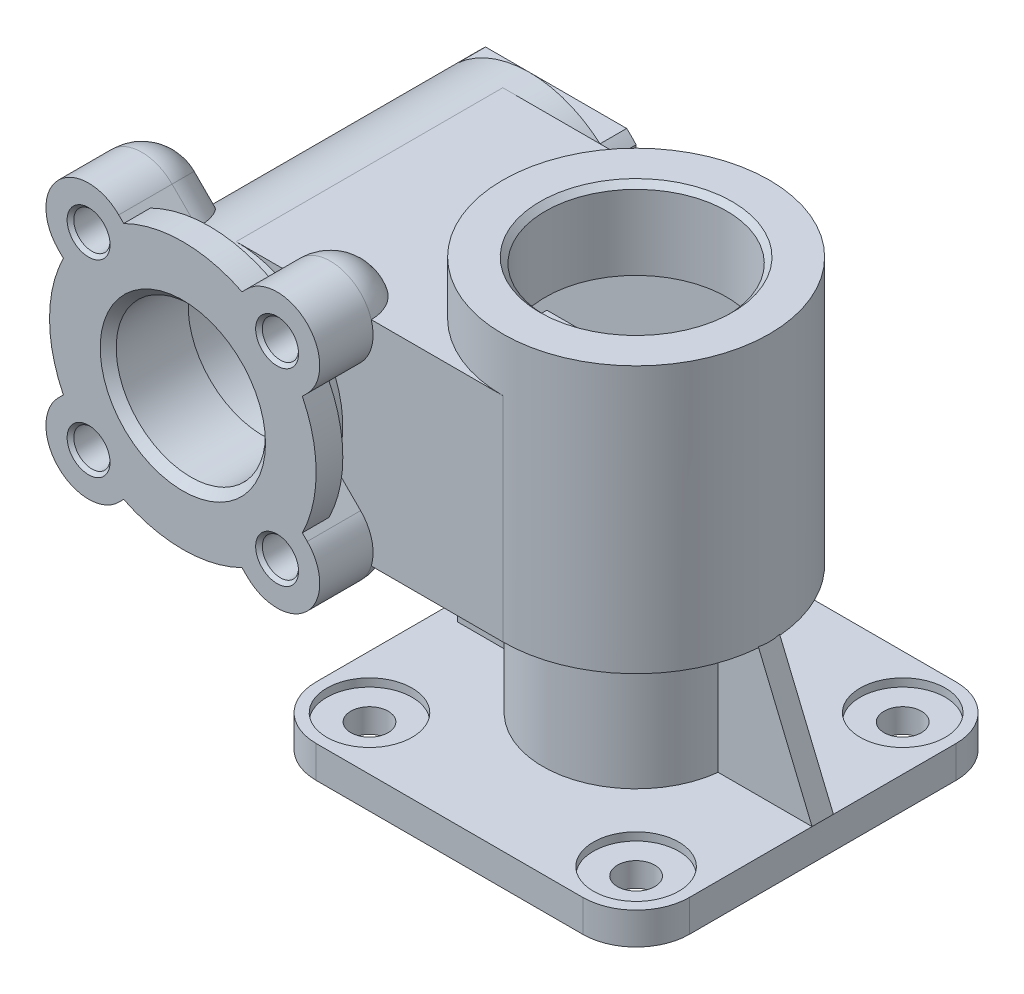
from build123d import *
from build123d.topology import SkipClean

# Parameters (mm, degrees)
EXTRUDE_1_DEPTH                            = 6
EXTRUDE_START                              = -6
SKETCH_2_R                                 = 17.5
EXTRUDE_2_DEPTH                            = 80
SKETCH_3_R                                 = 25
EXTRUDE_3_DEPTH                            = 50
SKETCH_5_R                                 = 20
EXTRUDE_4_DEPTH                            = 35
EXTRUDE_5_REACH                            = 113.915
EXTRUDE_5_END_RADIUS                       = 20
SKETCH_4_W                                 = 50
SKETCH_4_H                                 = 40
SKETCH_9_R                                 = 25
EXTRUDE_9_DEPTH                            = 5
EXTRUDE_8_DEPTH                            = 18
FILLET_1_R                                 = 8
PATTERN_CIRCULAR_7_COUNT                   = 4
CUT_EXTRUDE_START                          = -5
SKETCH_10_R                                = 20
CUT_EXTRUDE_2_DEPTH                        = 5
EXTRUDE_10_DEPTH                           = 5
RIB_1_REACH                                = 117.551
SKETCH_11_WALL_W                           = 259.102658406
SKETCH_11_WALL_H                           = 4
RIB_2_REACH                                = 117.551
SKETCH_12_WALL_W                           = 257.102658406
SKETCH_12_WALL_H                           = 4
SKETCH_13_R                                = 15
CUT_EXTRUDE_3_DEPTH                        = 20
CUT_EXTRUDE_START_2                        = -15
SKETCH_14_R                                = 20
CUT_EXTRUDE_4_DEPTH                        = 22
SKETCH_15_W                                = 50
SKETCH_15_H                                = 40
CUT_EXTRUDE_5_DEPTH                        = 22
SKETCH_16_R                                = 17.5
EXTRUDE_11_DEPTH                           = 3
F_25_0MM_1_D                               = 25
F_25_0MM_1_CSINK_D                         = 26.5
F_25_0MM_1_CSINK_ANGLE                     = 90
HOLE_WIZARD_M8_1_D                         = 6.8
HOLE_WIZARD_M8_1_DEPTH                     = 7.957073895
HOLE_WIZARD_M8_1_CSINK_D                   = 8.05
HOLE_WIZARD_M8_1_CSINK_ANGLE               = 90
HOLE_WIZARD_M8_1_TIP                       = 2.042926105
CUT_EXTRUDE_6_REACH                        = 132.488
SKETCH_23_R                                = 14
CHAMFER_1_SIZE                             = 1.5
M18X2_0_1_D                                = 16
M18X2_0_1_CSINK_D                          = 18.05
M18X2_0_1_CSINK_ANGLE                      = 90
SKETCH_27_R                                = 8
CUT_EXTRUDE_7_DEPTH                        = 1.5
CUT_EXTRUDE_8_REACH                        = 114.483
SKETCH_28_R                                = 3.5
MIRROR_1_AT_THE_SECOND_PLANE_COPY_1_SKET_R = 8
MIRROR_1_AT_THE_SECOND_PLANE_COPY_1_DEPTH  = 1.5
MIRROR_1_AT_THE_SECOND_PLANE_COPY_2_REACH  = 114.483
MIRROR_1_AT_THE_SECOND_PLANE_COPY_2_SKET_R = 3.5


with BuildPart() as part:
    # 草图1 → 凸台-拉伸1 (new body)
    with BuildSketch(Plane(origin=(0, 0, 0), x_dir=(1, 0, 0), z_dir=(0, 1, 0))):
        with BuildLine():
            Line((-25, -35), (25, -35))
            ThreePointArc((25, -35), (32.071067812, -32.071067812), (35, -25))
            Line((35, -25), (35, 25))
            ThreePointArc((35, 25), (32.071067812, 32.071067812), (25, 35))
            Line((25, 35), (-25, 35))
            ThreePointArc((-25, 35), (-32.071067812, 32.071067812), (-35, 25))
            Line((-35, 25), (-35, -25))
            ThreePointArc((-35, -25), (-32.071067812, -32.071067812), (-25, -35))
        make_face()
    extrude(amount=EXTRUDE_1_DEPTH)

    # 草图2 → 凸台-拉伸2 (add)
    with BuildSketch(Plane(origin=(0, 6, 0), x_dir=(1, 0, 0), z_dir=(0, 1, 0)).offset(EXTRUDE_START)):
        with Locations(Location((0, 0, 0), (0, 0, 270))):
            Circle(SKETCH_2_R)
    extrude(amount=EXTRUDE_2_DEPTH)

    # 草图3 → 凸台-拉伸3 (add)
    with BuildSketch(Plane(origin=(0, 80, 0), x_dir=(1, 0, 0), z_dir=(0, 1, 0))):
        with Locations(Location((0, 0, 0), (0, 0, 270))):
            Circle(SKETCH_3_R)
    extrude(amount=-EXTRUDE_3_DEPTH)



with BuildPart() as body_2:
    # 草图5 → 凸台-拉伸4 (new, symmetric)
    with BuildSketch(Plane.XY):
        with Locations((-50, 50)):
            Circle(SKETCH_5_R)
    extrude(amount=EXTRUDE_4_DEPTH, both=True)


with BuildPart() as part_1:
    add(part.part)

    add(body_2.part)  # 凸台-拉伸5 merges body 2
    # 凸台-拉伸5: up to this cylinder (the profile starts outside it)
    extrude_5_end = Plane(origin=(-50, 50, 0), z_dir=(0, 0, -1)) * Cylinder(EXTRUDE_5_END_RADIUS, 268.83, mode=Mode.PRIVATE)
    # 草图4 → 凸台-拉伸5 (add, up to the surface)
    with BuildSketch(Plane(origin=(0, 0, 0), x_dir=(0, 0, -1), z_dir=(1, 0, 0)), mode=Mode.PRIVATE) as extrude_5_sk1:
        with Locations((0, 50)):
            Rectangle(SKETCH_4_W, SKETCH_4_H)
    extrude_5_tool1 = extrude(extrude_5_sk1.sketch, amount=-EXTRUDE_5_REACH, mode=Mode.PRIVATE) - extrude_5_end
    add(extrude_5_tool1.solids().sort_by_distance((0, 50, 0))[0])

    # 草图9 → 凸台-拉伸9 (add)
    with BuildSketch(Plane.XY.offset(35)):
        with Locations((-50, 50)):
            Circle(SKETCH_9_R)
    extrude(amount=-EXTRUDE_9_DEPTH)


with BuildPart() as body_2_2:
    # 草图6 → 凸台-拉伸8 (new body)
    with BuildSketch(Plane.XY.offset(35)):
        with BuildLine():
            Line((-62.02081528, 73.334523779), (-44.343145751, 55.656854249))
            Line((-44.343145751, 55.656854249), (-55.656854249, 44.343145751))
            Line((-55.656854249, 44.343145751), (-73.334523779, 62.02081528))
            ThreePointArc((-73.334523779, 62.02081528), (-73.334523779, 73.334523779), (-62.02081528, 73.334523779))
        make_face()
    extrude(amount=-EXTRUDE_8_DEPTH)

    # 圆角1
    fillet_1_edges = [body_2_2.edges().sort_by_distance(p)[0] for p in [
        (-64.495689014, 53.181980515, 17),
        (-73.334523779, 73.334523779, 17),
        (-53.181980515, 64.495689014, 17),
    ]]
    fillet(fillet_1_edges, radius=FILLET_1_R - 0.0001)  # a hair under: the kernel refuses the full size


with BuildPart() as pattern_circular_7_1:
    # 阵列(圆周)7: pattern copy
    add(body_2_2.part.rotate(Axis((-50, 50, 0), (0, 0, 1)), 1 * 360 / PATTERN_CIRCULAR_7_COUNT))


with BuildPart() as pattern_circular_7_2:
    # 阵列(圆周)7: pattern copy
    add(body_2_2.part.rotate(Axis((-50, 50, 0), (0, 0, 1)), 2 * 360 / PATTERN_CIRCULAR_7_COUNT))


with BuildPart() as pattern_circular_7_3:
    # 阵列(圆周)7: pattern copy
    add(body_2_2.part.rotate(Axis((-50, 50, 0), (0, 0, 1)), 3 * 360 / PATTERN_CIRCULAR_7_COUNT))


with BuildPart() as part_2:
    add(part_1.part)

    # 相交1: read off the stored shape, not the designer's step
    # 相交1: union 阵列(圆周)7_3, 阵列(圆周)7_2, 阵列(圆周)7_1, body 2 2
    add(pattern_circular_7_3.part)
    add(pattern_circular_7_2.part)
    add(pattern_circular_7_1.part)
    add(body_2_2.part)

    # 草图10 → 切除-拉伸2 (cut)
    with BuildSketch(Plane(origin=(0, 0, -35), x_dir=(-1, 0, 0), z_dir=(0, 0, -1)).offset(CUT_EXTRUDE_START)):
        with Locations((50, 50)):
            Circle(SKETCH_10_R)
    extrude(amount=CUT_EXTRUDE_2_DEPTH, mode=Mode.SUBTRACT)

    # 草图7 → 凸台-拉伸10 (add)
    with SkipClean():  # the faces are left unmerged after this step: merging them gives an invalid solid
        with BuildSketch(Plane(origin=(0, 0, -30), x_dir=(-1, 0, 0), z_dir=(0, 0, -1))):
            with BuildLine():
                Line((36.771243445, 35), (63.228756555, 35))
                ThreePointArc((63.228756555, 35), (64.142135624, 35.857864376), (65, 36.771243445))
                Line((65, 36.771243445), (65, 63.228756555))
                ThreePointArc((65, 63.228756555), (64.142135624, 64.142135624), (63.228756555, 65))
                Line((63.228756555, 65), (36.771243445, 65))
                ThreePointArc((36.771243445, 65), (35.857864376, 64.142135624), (35, 63.228756555))
                Line((35, 63.228756555), (35, 36.771243445))
                ThreePointArc((35, 36.771243445), (35.857864376, 35.857864376), (36.771243445, 35))
            make_face()
        extrude(amount=EXTRUDE_10_DEPTH)

    # 草图11 wall → 筋1 (add, up to next)
    with BuildSketch(Plane(origin=(30, 18, 0), x_dir=(0.384615384615, -0.923076923077, 0), z_dir=(0.923076923077, 0.384615384615, 0)), mode=Mode.PRIVATE) as rib_1_sk1:
        Rectangle(SKETCH_11_WALL_W, SKETCH_11_WALL_H)
    rib_1_tool1 = extrude(rib_1_sk1.sketch, amount=-RIB_1_REACH, mode=Mode.PRIVATE) - part_2.part
    add(rib_1_tool1.solids().sort_by_distance((30, 18, 0))[0])

    # 草图12 wall → 筋2 (add, up to next)
    with BuildSketch(Plane(origin=(-31.5, 18, 0), x_dir=(0, 1, 0), z_dir=(-1, 0, 0)), mode=Mode.PRIVATE) as rib_2_sk1:
        Rectangle(SKETCH_12_WALL_W, SKETCH_12_WALL_H)
    rib_2_tool1 = extrude(rib_2_sk1.sketch, amount=-RIB_2_REACH, mode=Mode.PRIVATE) - part_2.part
    add(rib_2_tool1.solids().sort_by_distance((-31.5, 18, 0))[0])

    # 草图13 → 切除-拉伸3 (cut, symmetric)
    with SkipClean():  # the faces are left unmerged after this step: merging them gives an invalid solid
        with BuildSketch(Plane.XY):
            with Locations((-50, 50)):
                Circle(SKETCH_13_R)
        extrude(amount=CUT_EXTRUDE_3_DEPTH, both=True, mode=Mode.SUBTRACT)

    # 草图14 → 切除-拉伸4 (cut)
    with SkipClean():  # the faces are left unmerged after this step: merging them gives an invalid solid
        with BuildSketch(Plane(origin=(0, 80, 0), x_dir=(1, 0, 0), z_dir=(0, 1, 0)).offset(CUT_EXTRUDE_START_2)):
            with Locations(Location((0, 0, 0), (0, 0, 270))):
                Circle(SKETCH_14_R)
        extrude(amount=-CUT_EXTRUDE_4_DEPTH, mode=Mode.SUBTRACT)

    # 草图15 → 切除-拉伸5 (cut)
    with SkipClean():  # the faces are left unmerged after this step: merging them gives an invalid solid
        with BuildSketch(Plane(origin=(0, 43, 0), x_dir=(1, 0, 0), z_dir=(0, 1, 0))):
            with Locations((-25, 0)):
                Rectangle(SKETCH_15_W, SKETCH_15_H)
        extrude(amount=CUT_EXTRUDE_5_DEPTH, mode=Mode.SUBTRACT)

    # 草图16 → 凸台-拉伸11 (add)
    with SkipClean():  # the faces are left unmerged after this step: merging them gives an invalid solid
        with BuildSketch(Plane(origin=(0, 43, 0), x_dir=(1, 0, 0), z_dir=(0, 1, 0))):
            with Locations(Location((0, 0, 0), (0, 0, 270))):
                Circle(SKETCH_16_R)
        extrude(amount=EXTRUDE_11_DEPTH)

    # 草图18 → M36x2.0 螺纹孔1 (revolve, cut)
    with SkipClean():  # the faces are left unmerged after this step: merging them gives an invalid solid
        with BuildSketch(Plane(origin=(0, 80, 0), x_dir=(0, 0, 1), z_dir=(1, 0, 0))):
            Polygon((0, 0), (0, 15), (17, 15), (17, 1.025), (18.025, 0), align=None)
        revolve(axis=Axis((0, 86.35, 0), (0, -1, 0)), mode=Mode.SUBTRACT)

    # Ø25.0mm 暗销孔1 (through all)
    with Locations(Plane(origin=(0, 46, 0), x_dir=(1, 0, 0), z_dir=(0, 1, 0))):
        with Locations((0, 0)):
            CounterSinkHole(F_25_0MM_1_D / 2, F_25_0MM_1_CSINK_D / 2, counter_sink_angle=F_25_0MM_1_CSINK_ANGLE)

    # M8 螺纹孔1
    with Locations(Plane.XY.offset(35)):
        with Locations((-32.32233047, 32.32233047), (-67.67766953, 32.32233047), (-67.67766953, 67.67766953), (-32.32233047, 67.67766953)):
            CounterSinkHole(HOLE_WIZARD_M8_1_D / 2, HOLE_WIZARD_M8_1_CSINK_D / 2, depth=HOLE_WIZARD_M8_1_DEPTH, counter_sink_angle=HOLE_WIZARD_M8_1_CSINK_ANGLE)
            with Locations((0, 0, -(HOLE_WIZARD_M8_1_DEPTH + HOLE_WIZARD_M8_1_TIP / 2))):  # 118° drill point
                Cone(0, HOLE_WIZARD_M8_1_D / 2, HOLE_WIZARD_M8_1_TIP, mode=Mode.SUBTRACT)

    # 草图23 → 切除-拉伸6 (cut, up to next)
    with BuildSketch(Plane.XY.offset(35), mode=Mode.PRIVATE) as cut_extrude_6_sk1:
        with Locations((-50, 50)):
            Circle(SKETCH_23_R)
    cut_extrude_6_tool1 = extrude(cut_extrude_6_sk1.sketch, amount=-CUT_EXTRUDE_6_REACH, mode=Mode.PRIVATE) & part_2.part
    add(cut_extrude_6_tool1.solids().sort_by_distance((-50, 50, 35))[0], mode=Mode.SUBTRACT)

    # 倒角1
    chamfer_1_edges = [part_2.edges().sort_by_distance(p)[0] for p in [
        (-64, 50, 35),
    ]]
    chamfer(chamfer_1_edges, length=CHAMFER_1_SIZE)

    # M18x2.0 螺纹孔1 (through all)
    with Locations(Plane(origin=(0, 0, -35), x_dir=(-1, 0, 0), z_dir=(0, 0, -1))):
        with Locations((50, 50)):
            CounterSinkHole(M18X2_0_1_D / 2, M18X2_0_1_CSINK_D / 2, counter_sink_angle=M18X2_0_1_CSINK_ANGLE)

    # 草图27 → 切除-拉伸7 (cut)
    with SkipClean():  # the faces are left unmerged after this step: merging them gives an invalid solid
        with BuildSketch(Plane(origin=(0, 6, 0), x_dir=(1, 0, 0), z_dir=(0, 1, 0))):
            with Locations(Location((25, -25, 0), (0, 0, 270))):
                Circle(SKETCH_27_R)
        cut_extrude_7 = extrude(amount=-CUT_EXTRUDE_7_DEPTH, mode=Mode.SUBTRACT)

    # 草图28 → 切除-拉伸8 (cut, up to next)
    with BuildSketch(Plane(origin=(0, 4.5, 0), x_dir=(1, 0, 0), z_dir=(0, 1, 0)), mode=Mode.PRIVATE) as cut_extrude_8_sk1:
        with Locations(Location((25, -25, 0), (0, 0, 270))):
            Circle(SKETCH_28_R)
    cut_extrude_8_tool1 = extrude(cut_extrude_8_sk1.sketch, amount=-CUT_EXTRUDE_8_REACH, mode=Mode.PRIVATE) & part_2.part
    cut_extrude_8 = cut_extrude_8_tool1.solids().sort_by_distance((25, 4.5, 25))[0]
    add(cut_extrude_8, mode=Mode.SUBTRACT)

    # 镜向1: 切除-拉伸7, 切除-拉伸8 across plane
    with SkipClean():  # the faces are left unmerged after this step: merging them gives an invalid solid
        add(cut_extrude_7.mirror(Plane(origin=(0, 0, 0), x_dir=(0, 0, 1), z_dir=(1, 0, 0))), mode=Mode.SUBTRACT)
        add(cut_extrude_8.mirror(Plane(origin=(0, 0, 0), x_dir=(0, 0, 1), z_dir=(1, 0, 0))), mode=Mode.SUBTRACT)

    # 镜向1 at the second plane: 切除-拉伸7, 切除-拉伸8 across plane
    with SkipClean():  # the faces are left unmerged after this step: merging them gives an invalid solid
        add(cut_extrude_7.mirror(Plane.XY), mode=Mode.SUBTRACT)
        add(cut_extrude_8.mirror(Plane.XY), mode=Mode.SUBTRACT)

    # 镜向1 at the second plane copy 1 sket → 镜向1 at the second plane copy 1 (cut)
    with SkipClean():  # the faces are left unmerged after this step: merging them gives an invalid solid
        with BuildSketch(Plane(origin=(0, 6, 0), x_dir=(-1, 0, 0), z_dir=(0, 1, 0))):
            with Locations(Location((25, -25, 0), (0, 0, 270))):
                Circle(MIRROR_1_AT_THE_SECOND_PLANE_COPY_1_SKET_R)
        extrude(amount=-MIRROR_1_AT_THE_SECOND_PLANE_COPY_1_DEPTH, mode=Mode.SUBTRACT)

    # 镜向1 at the second plane copy 2 sket → 镜向1 at the second plane copy 2 (cut, up to next)
    with BuildSketch(Plane(origin=(0, 4.5, 0), x_dir=(-1, 0, 0), z_dir=(0, 1, 0)), mode=Mode.PRIVATE) as mirror_1_at_the_second_plane_copy_2_sk1:
        with Locations(Location((25, -25, 0), (0, 0, 270))):
            Circle(MIRROR_1_AT_THE_SECOND_PLANE_COPY_2_SKET_R)
    mirror_1_at_the_second_plane_copy_2_tool1 = extrude(mirror_1_at_the_second_plane_copy_2_sk1.sketch, amount=-MIRROR_1_AT_THE_SECOND_PLANE_COPY_2_REACH, mode=Mode.PRIVATE) & part_2.part
    add(mirror_1_at_the_second_plane_copy_2_tool1.solids().sort_by_distance((-25, 4.5, -25))[0], mode=Mode.SUBTRACT)


solid = part_2.part
